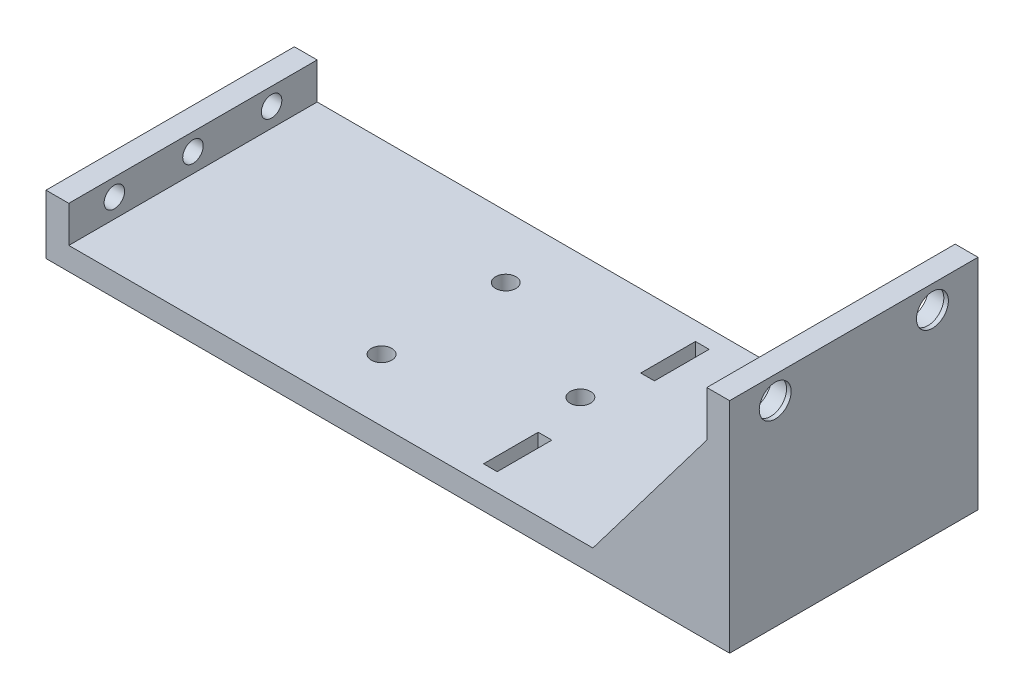
from build123d import *

# Parameters (mm, degrees)
SKETCH1_W                 = 150
SKETCH1_H                 = 54.5
BOSS_EXTRUDE1_DEPTH       = 5
SKETCH2_W                 = 5
SKETCH2_H                 = 54.5
BOSS_EXTRUDE2_DEPTH       = 8
F_8_CLEARANCE_HOLE1_D     = 4.4958
F_8_CLEARANCE_HOLE1_DEPTH = 17
F_8_CLEARANCE_HOLE1_TIP   = 1.350674586
SKETCH7_W                 = 5
SKETCH7_H                 = 54.5
BOSS_EXTRUDE3_DEPTH       = 43
SKETCH8_R                 = 4.25
CUT_EXTRUDE1_DEPTH        = 4
RIB1_REACH                = 120.085
SKETCH10_WALL_W           = 279.571445908
SKETCH10_WALL_H           = 10
RIB3_REACH                = 120.085
SKETCH12_WALL_W           = 279.571445908
SKETCH12_WALL_H           = 10
SKETCH13_W                = 8
SKETCH13_H                = 2
BOSS_EXTRUDE4_DEPTH       = 5
SKETCH14_R                = 2
CUT_EXTRUDE2_DEPTH        = 2
SKETCH15_R                = 3.5
CUT_EXTRUDE3_DEPTH        = 1
SKETCH16_W                = 3
SKETCH16_H                = 12
CUT_EXTRUDE4_DEPTH        = 5
F_8_CLEARANCE_HOLE2_D     = 4.4958
F_8_CLEARANCE_HOLE2_DEPTH = 17
F_8_CLEARANCE_HOLE2_TIP   = 1.350674586


with BuildPart() as part:
    # Sketch1 → Boss-Extrude1 (new body)
    with BuildSketch(Plane(origin=(0, 0, 0), x_dir=(1, 0, 0), z_dir=(0, 1, 0))):
        with Locations((-18.112463826, -1.689393939)):
            Rectangle(SKETCH1_W, SKETCH1_H)
    extrude(amount=BOSS_EXTRUDE1_DEPTH)

    # Sketch2 → Boss-Extrude2 (add)
    with BuildSketch(Plane(origin=(0, 5, 0), x_dir=(1, 0, 0), z_dir=(0, 1, 0))):
        with Locations((-90.612463826, -1.689393939)):
            Rectangle(SKETCH2_W, SKETCH2_H)
    extrude(amount=BOSS_EXTRUDE2_DEPTH)

    # #8 Clearance Hole1
    with Locations(Plane(origin=(-93.112463826, 9.2, -15.560606061), x_dir=(0, 0, -1), z_dir=(-1, 0, 0))):
        with Locations((0, 0), (-17.25, 0), (-34.5, 0)):
            Hole(F_8_CLEARANCE_HOLE1_D / 2, depth=F_8_CLEARANCE_HOLE1_DEPTH)
            with Locations((0, 0, -(F_8_CLEARANCE_HOLE1_DEPTH + F_8_CLEARANCE_HOLE1_TIP / 2))):  # 118° drill point
                Cone(0, F_8_CLEARANCE_HOLE1_D / 2, F_8_CLEARANCE_HOLE1_TIP, mode=Mode.SUBTRACT)

    # Sketch7 → Boss-Extrude3 (add)
    with BuildSketch(Plane(origin=(0, 5, 0), x_dir=(1, 0, 0), z_dir=(0, 1, 0))):
        with Locations((54.387536174, -1.689393939)):
            Rectangle(SKETCH7_W, SKETCH7_H)
    extrude(amount=BOSS_EXTRUDE3_DEPTH)

    # Sketch8 → Cut-Extrude1 (cut)
    with BuildSketch(Plane.ZY.offset(-51.887536174)):
        with Locations((-15.560606061, 43)):
            Circle(SKETCH8_R)
        with Locations((18.939393939, 43)):
            Circle(SKETCH8_R)
    extrude(amount=-CUT_EXTRUDE1_DEPTH, mode=Mode.SUBTRACT)

    # Sketch10 wall → Rib1 (add, up to next)
    with BuildSketch(Plane(origin=(39.387536174, 21.5, -25.560606061), x_dir=(-0.603857687995, -0.797092148154, 0), z_dir=(-0.797092148154, 0.603857687995, 0)), mode=Mode.PRIVATE) as rib1_sk1:
        with Locations((0, 5)):
            Rectangle(SKETCH10_WALL_W, SKETCH10_WALL_H)
    rib1_tool1 = extrude(rib1_sk1.sketch, amount=-RIB1_REACH, mode=Mode.PRIVATE) - part.part
    add(rib1_tool1.solids().sort_by_distance((39.387536174, 21.5, -25.560606061))[0])

    # Sketch12 wall → Rib3 (add, up to next)
    with BuildSketch(Plane(origin=(39.387536174, 21.5, 28.939393939), x_dir=(-0.603857687995, -0.797092148154, 0), z_dir=(0.797092148154, -0.603857687995, 0)), mode=Mode.PRIVATE) as rib3_sk1:
        with Locations((0, 5)):
            Rectangle(SKETCH12_WALL_W, SKETCH12_WALL_H)
    rib3_tool1 = extrude(rib3_sk1.sketch, amount=RIB3_REACH, mode=Mode.PRIVATE) - part.part
    add(rib3_tool1.solids().sort_by_distance((39.387536174, 21.5, 28.939393939))[0])

    # Sketch13 → Boss-Extrude4 (add)
    with BuildSketch(Plane.ZY.offset(-51.887536174)):
        with Locations((1.689393939, 37)):
            Rectangle(SKETCH13_W, SKETCH13_H)
    extrude(amount=BOSS_EXTRUDE4_DEPTH)

    # Sketch14 → Cut-Extrude2 (cut)
    with BuildSketch(Plane(origin=(0, 38, 0), x_dir=(1, 0, 0), z_dir=(0, 1, 0))):
        with Locations((49.387536174, -1.689393939)):
            Circle(SKETCH14_R)
    extrude(amount=-CUT_EXTRUDE2_DEPTH, mode=Mode.SUBTRACT)

    # Sketch15 → Cut-Extrude3 (cut)
    with BuildSketch(Plane.ZY.offset(-55.887536174)):
        with Locations((-15.560606061, 43)):
            Circle(SKETCH15_R)
        with Locations((18.939393939, 43)):
            Circle(SKETCH15_R)
    extrude(amount=-CUT_EXTRUDE3_DEPTH, mode=Mode.SUBTRACT)

    # Sketch16 → Cut-Extrude4 (cut)
    with BuildSketch(Plane(origin=(0, 5, 0), x_dir=(1, 0, 0), z_dir=(0, 1, 0))):
        with Locations((0.387536174, 15.560606061)):
            Rectangle(SKETCH16_W, SKETCH16_H)
        with Locations((0.387536174, -18.939393939)):
            Rectangle(SKETCH16_W, SKETCH16_H)
    extrude(amount=-CUT_EXTRUDE4_DEPTH, mode=Mode.SUBTRACT)

    # #8 Clearance Hole2
    with Locations(Plane(origin=(-3.112463826, 5, 1.689393939), x_dir=(0, 0, 1), z_dir=(0, 1, 0))):
        with Locations((0, 0), (13.625, -30), (-13.625, -30)):
            Hole(F_8_CLEARANCE_HOLE2_D / 2, depth=F_8_CLEARANCE_HOLE2_DEPTH)
            with Locations((0, 0, -(F_8_CLEARANCE_HOLE2_DEPTH + F_8_CLEARANCE_HOLE2_TIP / 2))):  # 118° drill point
                Cone(0, F_8_CLEARANCE_HOLE2_D / 2, F_8_CLEARANCE_HOLE2_TIP, mode=Mode.SUBTRACT)


solid = part.part
